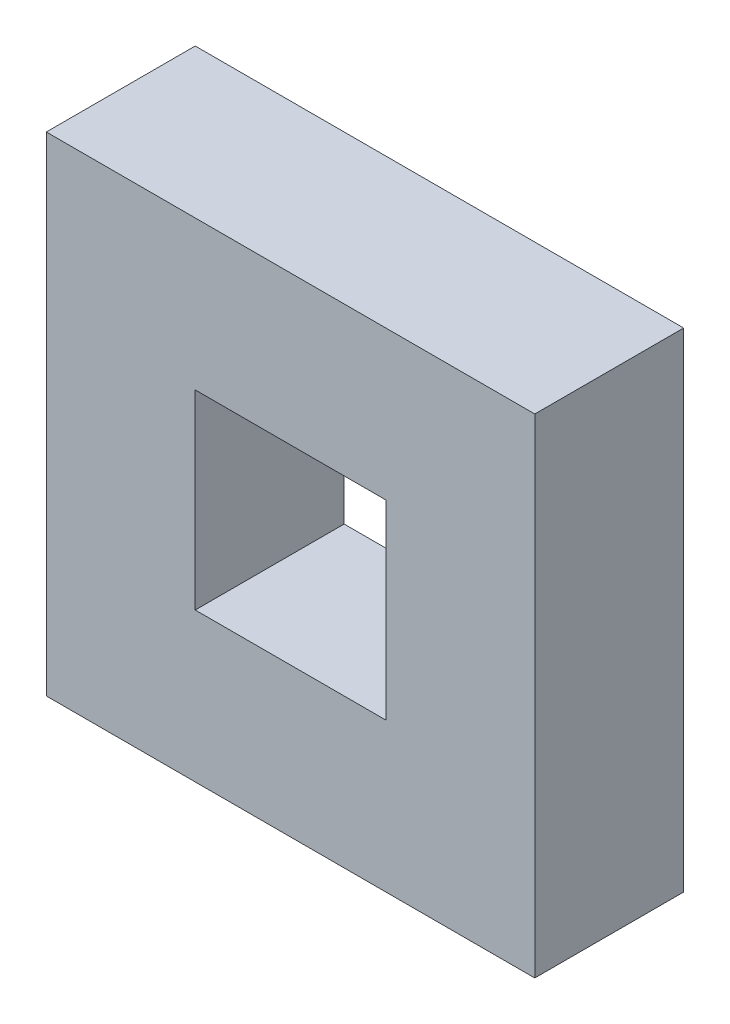
from build123d import *

# Parameters (mm, degrees)
SKETCH1_W           = 20.828
SKETCH1_H           = 20.828
SKETCH1_W_2         = 8.128
SKETCH1_H_2         = 8.128
BOSS_EXTRUDE1_DEPTH = 6.35


with BuildPart() as part:
    # Sketch1 → Boss-Extrude1 (new body)
    with BuildSketch(Plane.XY):
        with Locations((10.414, 10.414)):
            Rectangle(SKETCH1_W, SKETCH1_H)
        with Locations((10.414, 10.414)):
            Rectangle(SKETCH1_W_2, SKETCH1_H_2, mode=Mode.SUBTRACT)
    extrude(amount=BOSS_EXTRUDE1_DEPTH)


solid = part.part
